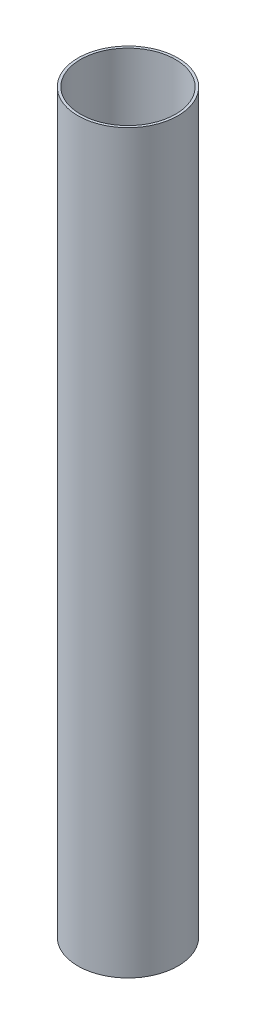
from build123d import *

# Parameters (mm, degrees)
SKETCH1_R           = 33.9725
SKETCH1_R_2         = 32.258
BOSS_EXTRUDE1_DEPTH = 500


with BuildPart() as part:
    # Sketch1 → Boss-Extrude1 (new body)
    with BuildSketch(Plane(origin=(0, 0, 0), x_dir=(1, 0, 0), z_dir=(0, 1, 0))):
        Circle(SKETCH1_R)
        Circle(SKETCH1_R_2, mode=Mode.SUBTRACT)
    extrude(amount=BOSS_EXTRUDE1_DEPTH)


solid = part.part
